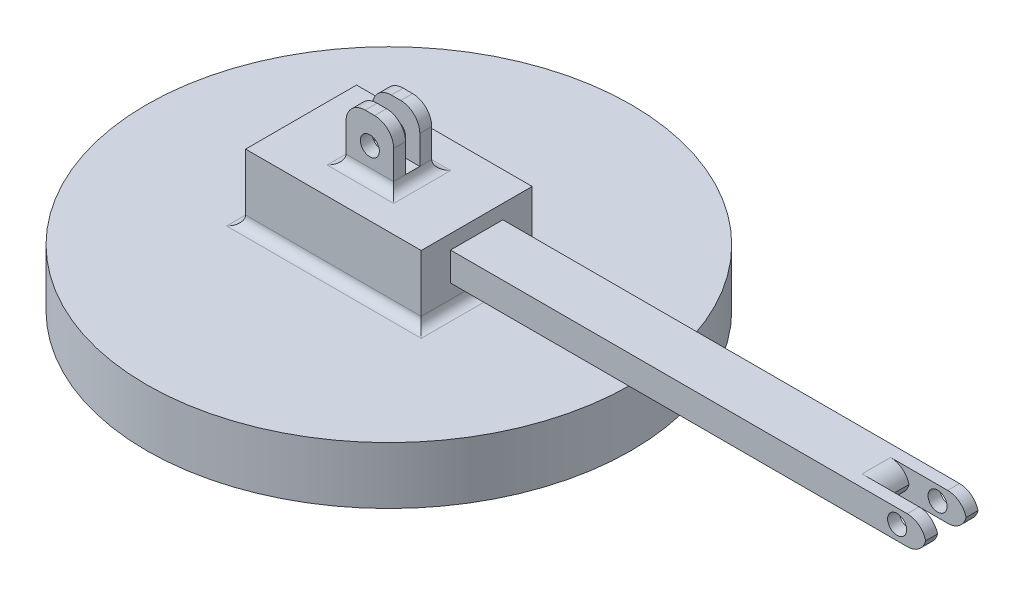
from build123d import *

# Parameters (mm, degrees)
SKETCH1_R           = 25.48
BOSS_EXTRUDE1_DEPTH = 6
SKETCH2_W           = 18.454793018
SKETCH2_H           = 11.657566824
BOSS_EXTRUDE2_DEPTH = 7
FILLET1_R           = 1
SKETCH3_W           = 5.5
SKETCH3_H           = 3
BOSS_EXTRUDE3_DEPTH = 50
SKETCH7_W           = 6
SKETCH7_H           = 3
CUT_EXTRUDE3_DEPTH  = 66.493243142
FILLET3_R           = 2
SKETCH9_W           = 5
SKETCH9_H           = 4
BOSS_EXTRUDE4_DEPTH = 6
FILLET4_R           = 1
SKETCH10_W          = 9.060277754
SKETCH10_H          = 1.5
CUT_EXTRUDE5_DEPTH  = 5
SKETCH11_R          = 1
CUT_EXTRUDE6_DEPTH  = 68.944948781
FILLET5_R           = 2
FILLET6_R           = 2
SKETCH13_R          = 1
CUT_EXTRUDE7_DEPTH  = 69.251729391


with BuildPart() as part:
    # Sketch1 → Boss-Extrude1 (new body)
    with BuildSketch(Plane(origin=(0, 0, 0), x_dir=(1, 0, 0), z_dir=(0, 1, 0))):
        with Locations(Location((0, 0, 0), (0, 0, 270))):
            Circle(SKETCH1_R)
    extrude(amount=BOSS_EXTRUDE1_DEPTH)

    # Sketch2 → Boss-Extrude2 (add)
    with BuildSketch(Plane(origin=(0, 6, 0), x_dir=(1, 0, 0), z_dir=(0, 1, 0))):
        Rectangle(SKETCH2_W, SKETCH2_H)
    extrude(amount=BOSS_EXTRUDE2_DEPTH)

    # Fillet1
    fillet1_edges = [part.edges().sort_by_distance(p)[0] for p in [
        (9.227396509, 6, 0),
        (0, 6, -5.828783412),
        (-9.227396509, 6, 0),
        (0, 6, 5.828783412),
    ]]
    fillet(fillet1_edges, radius=FILLET1_R)

    # Sketch9 → Boss-Extrude4 (add)
    with BuildSketch(Plane(origin=(0, 13, 0), x_dir=(1, 0, 0), z_dir=(0, 1, 0))):
        Rectangle(SKETCH9_W, SKETCH9_H)
    extrude(amount=BOSS_EXTRUDE4_DEPTH)

    # Fillet4
    fillet4_edges = [part.edges().sort_by_distance(p)[0] for p in [
        (2.5, 13, 0),
        (0, 13, -2),
        (-2.5, 13, 0),
        (0, 13, 2),
    ]]
    fillet(fillet4_edges, radius=FILLET4_R)

    # Sketch10 → Cut-Extrude5 (cut)
    with BuildSketch(Plane(origin=(0, 19, 0), x_dir=(1, 0, 0), z_dir=(0, 1, 0))):
        Rectangle(SKETCH10_W, SKETCH10_H)
    extrude(amount=-CUT_EXTRUDE5_DEPTH, mode=Mode.SUBTRACT)

    # Sketch11 → Cut-Extrude6 (cut, through all)
    with BuildSketch(Plane(origin=(0, 0, -2), x_dir=(-1, 0, 0), z_dir=(0, 0, -1))):
        with Locations((0, 16)):
            Circle(SKETCH11_R)
    extrude(amount=-CUT_EXTRUDE6_DEPTH, mode=Mode.SUBTRACT)

    # Fillet5
    fillet5_edges = [part.edges().sort_by_distance(p)[0] for p in [
        (2.5, 19, 1.375),
        (-2.5, 19, -1.375),
        (2.5, 19, -1.375),
        (-2.5, 19, 1.375),
    ]]
    fillet(fillet5_edges, radius=FILLET5_R)


with BuildPart() as body_2:
    # Sketch3 → Boss-Extrude3 (new body)
    with BuildSketch(Plane(origin=(9.227396509, 0, 0), x_dir=(0, 0, -1), z_dir=(1, 0, 0))):
        with Locations((0, 10)):
            Rectangle(SKETCH3_W, SKETCH3_H)
    extrude(amount=BOSS_EXTRUDE3_DEPTH)

    # Sketch7 → Cut-Extrude3 (cut, through all)
    with BuildSketch(Plane(origin=(0, 11.5, 0), x_dir=(1, 0, 0), z_dir=(0, 1, 0))):
        with Locations((56.227396509, 0)):
            Rectangle(SKETCH7_W, SKETCH7_H)
    extrude(amount=-CUT_EXTRUDE3_DEPTH, mode=Mode.SUBTRACT)

    # Fillet3
    # the kernel refuses this fillet: 2 mm, written as the material it takes off along each edge
    with BuildSketch(Plane(origin=(59.227396509, 8.5, -3.5), x_dir=(0, 1, 0), z_dir=(0, 0, 1)), Plane(origin=(59.227396509, 8.5, -7.75), x_dir=(0, 1, 0), z_dir=(0, 0, 1))) as fillet3_piece_1:
        with BuildLine():
            CenterArc((FILLET3_R, FILLET3_R), FILLET3_R, 180, 90)
            Line((0, FILLET3_R), (0, 0))
            Line((0, 0), (FILLET3_R, 0))
        make_face()
    extrude(amount=11.25, mode=Mode.SUBTRACT)
    with BuildSketch(Plane(origin=(59.227396509, 11.5, 7.75), x_dir=(-1, 0, 0), z_dir=(0, 0, -1)), Plane(origin=(59.227396509, 11.5, 3.5), x_dir=(-1, 0, 0), z_dir=(0, 0, -1))) as fillet3_piece_2:
        with BuildLine():
            CenterArc((FILLET3_R, -FILLET3_R), FILLET3_R, 90, 90)
            Line((0, -FILLET3_R), (0, 0))
            Line((0, 0), (FILLET3_R, 0))
        make_face()
    extrude(amount=11.25, mode=Mode.SUBTRACT)

    # Fillet6
    # the kernel refuses this fillet: 2 mm, written as the material it takes off along each edge
    with BuildSketch(Plane(origin=(53.227396509, 8.5, -1.5), x_dir=(0, 1, 0), z_dir=(0, 0, 1))) as fillet6_piece_1:
        with BuildLine():
            CenterArc((FILLET6_R, FILLET6_R), FILLET6_R, 180, 90)
            Line((0, FILLET6_R), (0, 0))
            Line((0, 0), (FILLET6_R, 0))
        make_face()
    extrude(amount=3, mode=Mode.SUBTRACT)
    with BuildSketch(Plane(origin=(53.227396509, 11.5, 1.5), x_dir=(-1, 0, 0), z_dir=(0, 0, -1))) as fillet6_piece_2:
        with BuildLine():
            CenterArc((FILLET6_R, -FILLET6_R), FILLET6_R, 90, 90)
            Line((0, -FILLET6_R), (0, 0))
            Line((0, 0), (FILLET6_R, 0))
        make_face()
    extrude(amount=3, mode=Mode.SUBTRACT)

    # Sketch13 → Cut-Extrude7 (cut, through all)
    with BuildSketch(Plane(origin=(0, 0, -2.75), x_dir=(-1, 0, 0), z_dir=(0, 0, -1))):
        with Locations(Location((-56.163888182, 10, 0), (0, 0, 90))):
            Circle(SKETCH13_R)
    extrude(amount=-CUT_EXTRUDE7_DEPTH, mode=Mode.SUBTRACT)


solid = Compound([part.part, body_2.part])
